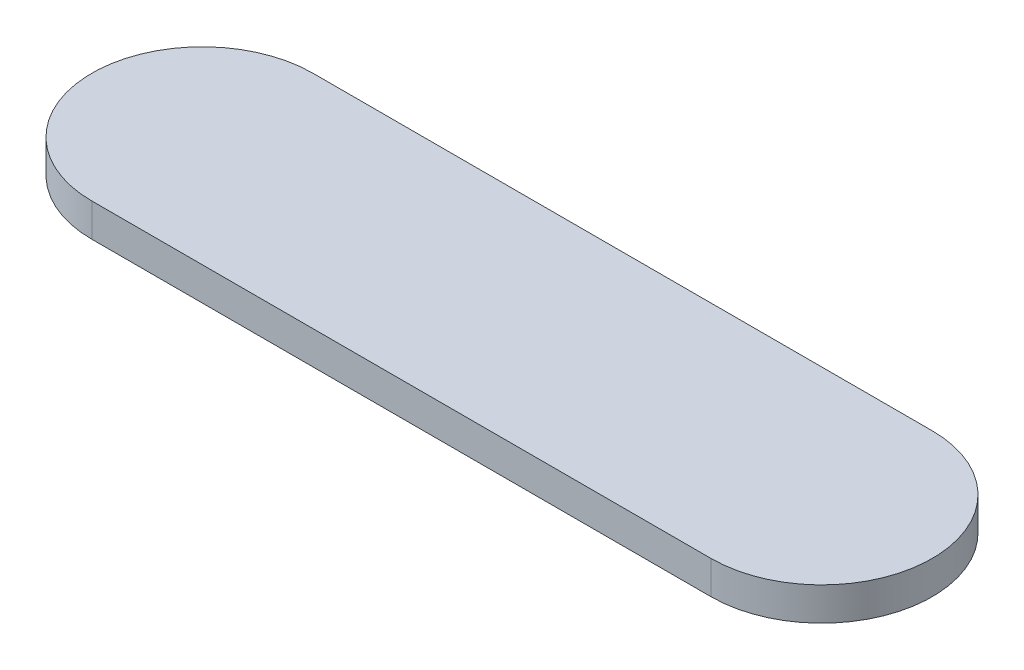
from build123d import *

# Parameters (mm, degrees)
BOSS_EXTRUDE1_DEPTH = 4.5


with BuildPart() as part:
    # Sketch2 → Boss-Extrude1 (new body)
    with BuildSketch(Plane(origin=(0, 0, 0), x_dir=(1, 0, 0), z_dir=(0, 1, 0))):
        with BuildLine():
            Line((42, 15), (-42, 15))
            ThreePointArc((-42, 15), (-57, 0), (-42, -15))
            Line((-42, -15), (42, -15))
            ThreePointArc((42, -15), (57, 0), (42, 15))
        make_face()
    extrude(amount=BOSS_EXTRUDE1_DEPTH)


solid = part.part
